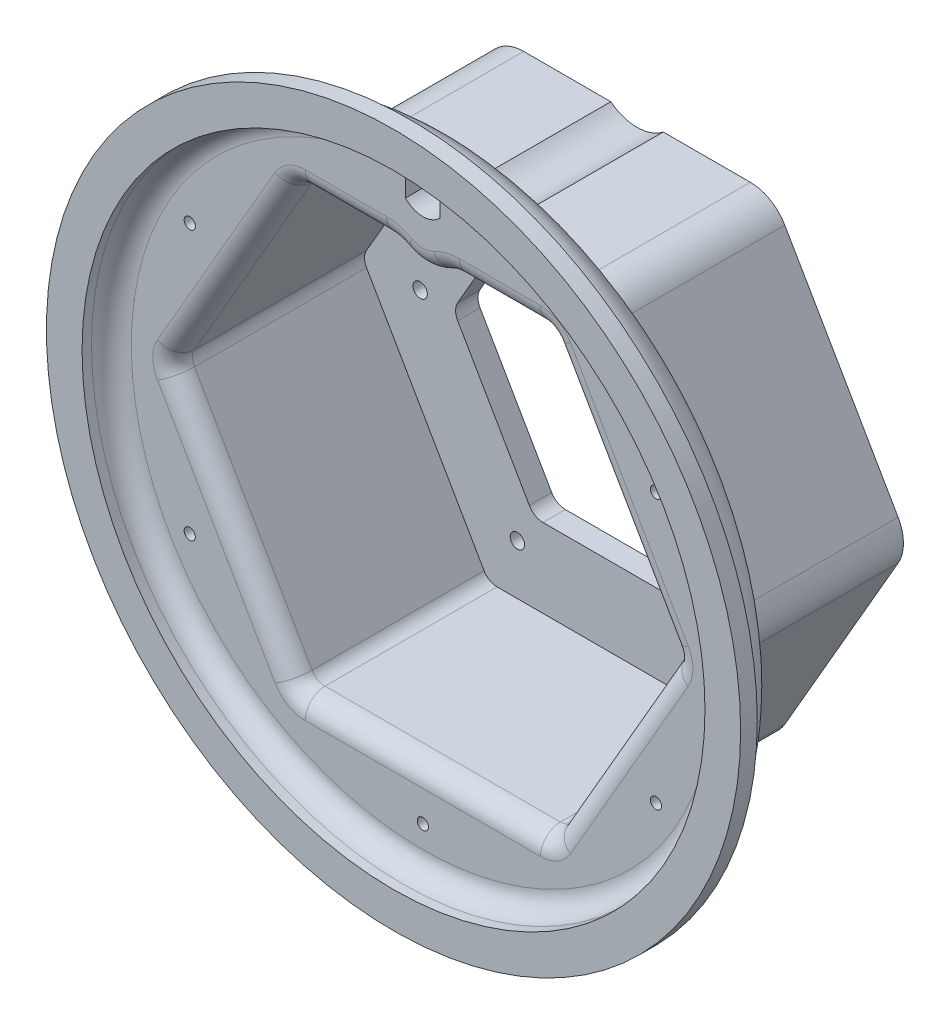
from build123d import *

# Parameters (mm, degrees)
BOSS_EXTRUDE1_DEPTH  = 65
BOSS_EXTRUDE2_START  = 9
BOSS_EXTRUDE2_DEPTH  = 9
SKETCH6_R            = 132.3
BOSS_EXTRUDE3_DEPTH  = 12.2
CUT_EXTRUDE1_REACH   = 204.402
SKETCH3_R            = 2.9
FILLET1_R            = 6.35
FILLET2_R            = 6
FILLET3_R            = 14
FILLET6_R            = 14
SKETCH12_R           = 131.85493252
SKETCH12_R_2         = 125.35493252
BOSS_EXTRUDE5_DEPTH  = 5.1
SKETCH13_R           = 139.7
SKETCH13_R_2         = 125.35493252
BOSS_EXTRUDE7_DEPTH  = 6.7
FILLET7_R            = 8
FILLET8_R            = 4
FILLET9_R            = 8
CUT_EXTRUDE2_DEPTH   = 211.969618666
CIRPATTERN1_COUNT    = 6
FILLET11_R           = 16
FILLET10_R           = 4
M4_CLEARANCE_HOLE1_D = 4.5
CIRPATTERN2_COUNT    = 6


with BuildPart() as part:
    # Sketch1 → Boss-Extrude1 (new body)
    with BuildSketch(Plane.XY):
        with BuildLine():
            Line((109.696551146, 0), (54.848275573, 95))
            Line((54.848275573, 95), (10.560528181, 95))
            ThreePointArc((10.560528181, 95), (0, 91.321983506), (-10.560528181, 95))
            Line((-10.560528181, 95), (-54.848275573, 95))
            Line((-54.848275573, 95), (-109.696551146, 0))
            Line((-109.696551146, 0), (-54.848275573, -95))
            Line((-54.848275573, -95), (54.848275573, -95))
            Line((54.848275573, -95), (109.696551146, 0))
        make_face()
        with BuildLine():
            Line((101.613647377, 0), (50.806823689, 88))
            Line((50.806823689, 88), (10.560528181, 88))
            ThreePointArc((10.560528181, 88), (0, 84.321983506), (-10.560528181, 88))
            Line((-10.560528181, 88), (-50.806823689, 88))
            Line((-50.806823689, 88), (-101.613647377, 0))
            Line((-101.613647377, 0), (-50.806823689, -88))
            Line((-50.806823689, -88), (50.806823689, -88))
            Line((50.806823689, -88), (101.613647377, 0))
        make_face(mode=Mode.SUBTRACT)
    extrude(amount=BOSS_EXTRUDE1_DEPTH)

    # Sketch2 → Boss-Extrude2 (add)
    with BuildSketch(Plane(origin=(0, 0, 0), x_dir=(-1, 0, 0), z_dir=(0, 0, -1)).offset(BOSS_EXTRUDE2_START)):
        with BuildLine():
            Line((109.696551146, 0), (54.848275573, 95))
            Line((54.848275573, 95), (10.560528181, 95))
            ThreePointArc((10.560528181, 95), (0, 91.321983506), (-10.560528181, 95))
            Line((-10.560528181, 95), (-54.848275573, 95))
            Line((-54.848275573, 95), (-109.696551146, 0))
            Line((-109.696551146, 0), (-54.848275573, -95))
            Line((-54.848275573, -95), (54.848275573, -95))
            Line((54.848275573, -95), (109.696551146, 0))
        make_face()
        Polygon((65, 0), (32.5, 56.291651246), (-32.5, 56.291651246), (-65, 0), (-32.5, -56.291651246), (32.5, -56.291651246), align=None, mode=Mode.SUBTRACT)
    extrude(amount=-BOSS_EXTRUDE2_DEPTH)

    # Sketch6 → Boss-Extrude3 (add)
    with BuildSketch(Plane.XY.offset(65)):
        Circle(SKETCH6_R)
        with BuildLine():
            Line((101.613647377, 0), (50.806823689, 88))
            Line((50.806823689, 88), (10.560528181, 88))
            ThreePointArc((10.560528181, 88), (0, 84.321983506), (-10.560528181, 88))
            Line((-10.560528181, 88), (-50.806823689, 88))
            Line((-50.806823689, 88), (-101.613647377, 0))
            Line((-101.613647377, 0), (-50.806823689, -88))
            Line((-50.806823689, -88), (50.806823689, -88))
            Line((50.806823689, -88), (101.613647377, 0))
        make_face(mode=Mode.SUBTRACT)
    extrude(amount=BOSS_EXTRUDE3_DEPTH)

    # Sketch3 → Cut-Extrude1 (cut, up to next)
    with BuildSketch(Plane.XY, mode=Mode.PRIVATE) as cut_extrude1_sk1:
        with Locations((78.3, 0)):
            Circle(SKETCH3_R)
    cut_extrude1_tool1 = extrude(cut_extrude1_sk1.sketch, amount=-CUT_EXTRUDE1_REACH, mode=Mode.PRIVATE) & part.part
    cut_extrude1 = cut_extrude1_tool1.solids().sort_by_distance((78.3, 0, 0))[0]
    add(cut_extrude1, mode=Mode.SUBTRACT)

    # Fillet1
    fillet1_edges = [part.edges().sort_by_distance(p)[0] for p in [
        (-65, 0, -4.5),
        (-32.5, 56.291651246, -4.5),
        (32.5, 56.291651246, -4.5),
        (65, 0, -4.5),
        (32.5, -56.291651246, -4.5),
        (-32.5, -56.291651246, -4.5),
    ]]
    fillet(fillet1_edges, radius=FILLET1_R)

    # Fillet2
    fillet2_edges = [part.edges().sort_by_distance(p)[0] for p in [
        (50.806823689, -88, 38.6),
        (101.613647377, 0, 38.6),
        (50.806823689, 88, 38.6),
        (-50.806823689, 88, 38.6),
        (-101.613647377, 0, 38.6),
        (-50.806823689, -88, 38.6),
    ]]
    fillet(fillet2_edges, radius=FILLET2_R)

    # Fillet3
    fillet3_edges = [part.edges().sort_by_distance(p)[0] for p in [
        (10.560528181, 88, 38.6),
        (-10.560528181, 88, 38.6),
    ]]
    fillet(fillet3_edges, radius=FILLET3_R)

    # Fillet6
    # the kernel refuses this fillet: 14 mm, written as the material it takes off along each edge
    with BuildSketch(Plane(origin=(0, 0, 65), x_dir=(1, 0, 0), z_dir=(0, -1, 0))) as fillet6_piece_1:
        with BuildLine():
            CenterArc((118.416196487, 14), FILLET6_R, 270, 82.612951564)
            Line((118.416196487, 0), (118.416196487, -0.28))
            Line((118.416196487, -0.28), (132.3, -0.28))
            Line((132.3, -0.28), (132.58, 0))
            ThreePointArc((132.58, 0), (132.58, 6.1), (132.57767607, 12.164))
            Line((132.57767607, 12.164), (132.3, 12.2))
        make_face()
    revolve(axis=Axis((0, 0, 65), (0, 0, 1)), mode=Mode.SUBTRACT)

    # Sketch12 → Boss-Extrude5 (add)
    with BuildSketch(Plane.XY.offset(77.2)):
        Circle(SKETCH12_R)
        Circle(SKETCH12_R_2, mode=Mode.SUBTRACT)
    extrude(amount=BOSS_EXTRUDE5_DEPTH)

    # Sketch13 → Boss-Extrude7 (add)
    with BuildSketch(Plane.XY.offset(82.3)):
        Circle(SKETCH13_R)
        Circle(SKETCH13_R_2, mode=Mode.SUBTRACT)
    extrude(amount=BOSS_EXTRUDE7_DEPTH)

    # Fillet7
    fillet7_edges = [part.edges().sort_by_distance(p)[0] for p in [
        (-125.35493252, 0, 77.2),
    ]]
    fillet(fillet7_edges, radius=FILLET7_R)

    # Fillet8
    fillet8_edges = [part.edges().sort_by_distance(p)[0] for p in [
        (-131.85493252, 0, 82.3),
    ]]
    fillet(fillet8_edges, radius=FILLET8_R)

    # Fillet9
    fillet9_edges = [part.edges().sort_by_distance(p)[0] for p in [
        (-76.210235533, -44, 77.2),
        (0, -88, 77.2),
        (76.210235533, -44, 77.2),
        (76.210235533, 44, 77.2),
        (30.994427629, 88, 77.2),
        (-76.210235533, 44, 77.2),
        (-50.342722074, -87.196152423, 77.2),
        (50.342722074, -87.196152423, 77.2),
        (100.685444147, 0, 77.2),
        (50.342722074, 87.196152423, 77.2),
        (-50.342722074, 87.196152423, 77.2),
        (-100.685444147, 0, 77.2),
        (0, 84.321983506, 77.2),
        (-30.994427629, 88, 77.2),
        (11.236253723, 87.578391733, 77.2),
        (-11.236253723, 87.578391733, 77.2),
    ]]
    fillet(fillet9_edges, radius=FILLET9_R)

    # Sketch9 → Cut-Extrude2 (cut, through all)
    with BuildSketch(Plane(origin=(0, 0, 65), x_dir=(-1, 0, 0), z_dir=(0, 0, -1))):
        with BuildLine():
            Line((7, 106.321983506), (7, 119.321983506))
            ThreePointArc((7, 119.321983506), (0, 122.321983506), (-7, 119.321983506))
            Line((-7, 119.321983506), (-7, 106.321983506))
            ThreePointArc((-7, 106.321983506), (0, 103.321983506), (7, 106.321983506))
        make_face()
    extrude(amount=-CUT_EXTRUDE2_DEPTH, mode=Mode.SUBTRACT)

    # CirPattern1: Cut-Extrude1 ×6 about axis
    cirpattern1_axis = Axis((0, 0, 0), (0, 0, 1))
    for i in range(1, CIRPATTERN1_COUNT):
        add(cut_extrude1.rotate(cirpattern1_axis, i * 360 / CIRPATTERN1_COUNT), mode=Mode.SUBTRACT)

    # Fillet11
    fillet11_edges = [part.edges().sort_by_distance(p)[0] for p in [
        (54.848275573, -95, 28),
        (-54.848275573, -95, 28),
        (-109.696551146, 0, 28),
        (-54.848275573, 95, 28),
        (54.848275573, 95, 28),
        (109.696551146, 0, 28),
    ]]
    fillet(fillet11_edges, radius=FILLET11_R)

    # Fillet10
    fillet10_edges = [part.edges().sort_by_distance(p)[0] for p in [
        (0, 91.321983506, 65),
        (-28.085599723, 95, 65),
        (-82.27241336, -47.5, 65),
        (-82.27241336, 47.5, 65),
        (28.085599723, 95, 65),
        (82.27241336, 47.5, 65),
        (82.27241336, -47.5, 65),
        (0, -95, 65),
        (-107.221342532, 0, 65),
        (-53.610671266, 92.856406461, 65),
        (53.610671266, 92.856406461, 65),
        (107.221342532, 0, 65),
        (53.610671266, -92.856406461, 65),
        (-53.610671266, -92.856406461, 65),
    ]]
    fillet(fillet10_edges, radius=FILLET10_R)

    # M4 Clearance Hole1 (through all)
    with Locations(Plane.XY.offset(77.2)):
        with Locations((93.812201865, 54.1625)):
            m4_clearance_hole1 = Hole(M4_CLEARANCE_HOLE1_D / 2)

    # CirPattern2: M4 Clearance Hole1 ×6 about axis, 1 skipped
    cirpattern2_axis = Axis((0, 0, 0), (0, 0, -1))
    add([m4_clearance_hole1.rotate(cirpattern2_axis, i * 360 / CIRPATTERN2_COUNT) for i in range(1, CIRPATTERN2_COUNT) if i not in (5,)], mode=Mode.SUBTRACT)


solid = part.part
